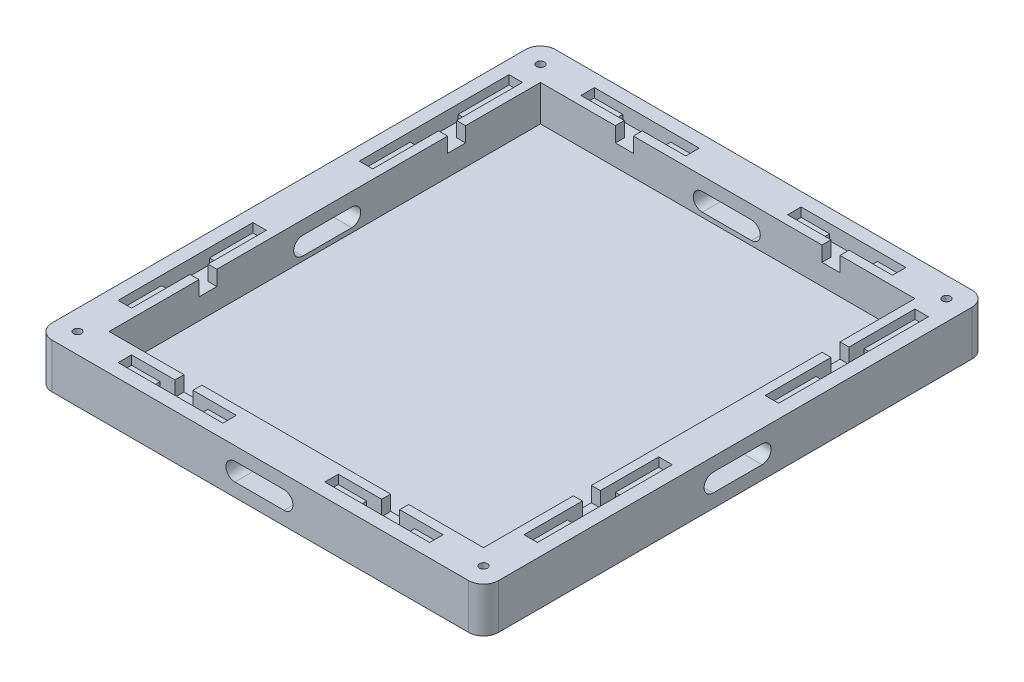
from build123d import *

# Parameters (mm, degrees)
FLOOR_2_DEPTH            = 3
BOSS_EXTRUDE1_DEPTH      = 12
BOSS_EXTRUDE1_DEPTH_BACK = 3
SKETCH4_W                = 149
SKETCH4_H                = 168
SKETCH4_W_2              = 125
SKETCH4_H_2              = 144
FILLET1_R                = 5
FILLET2_R                = 5
FILLET3_R                = 5
FILLET4_R                = 5
CUT_EXTRUDE1_DEPTH       = 3
CUT_EXTRUDE2_DEPTH       = 2
CUT_EXTRUDE3_DEPTH       = 172.703232352
CUT_EXTRUDE4_DEPTH       = 185.388855412
SKETCH9_R                = 1.325
CUT_EXTRUDE5_DEPTH       = 17
SKETCH10_R               = 3
CUT_EXTRUDE6_DEPTH       = 5
SKETCH11_R               = 6.25
CUT_EXTRUDE7_DEPTH       = 1


with BuildPart() as part:
    # Sketch1 → Floor 2 (new body)
    with BuildSketch(Plane(origin=(0, 0, 0), x_dir=(1, 0, 0), z_dir=(0, 1, 0))):
        Polygon((-62.5, 55.915), (-62.5, 72), (-47.54, 72), (46.365, 72), (62.5, 72), (62.5, 55.915), (62.5, -57.04), (62.5, -72), (46.365, -72), (-47.54, -72), (-62.5, -72), (-62.5, -57.04), align=None)
    extrude(amount=FLOOR_2_DEPTH)

    # Sketch4 → Boss-Extrude1 (add, two sides: drawn at the far end of the back side and taken through both)
    with BuildSketch(Plane(origin=(0, 3, 0), x_dir=(1, 0, 0), z_dir=(0, 1, 0)).offset(-BOSS_EXTRUDE1_DEPTH_BACK)):
        Rectangle(SKETCH4_W, SKETCH4_H)
        Rectangle(SKETCH4_W_2, SKETCH4_H_2, mode=Mode.SUBTRACT)
    extrude(amount=BOSS_EXTRUDE1_DEPTH + BOSS_EXTRUDE1_DEPTH_BACK)

    # Fillet1
    fillet1_edges = [part.edges().sort_by_distance(p)[0] for p in [
        (-74.5, 7.5, 84),
    ]]
    fillet(fillet1_edges, radius=FILLET1_R)

    # Fillet2
    fillet2_edges = [part.edges().sort_by_distance(p)[0] for p in [
        (74.5, 7.5, 84),
    ]]
    fillet(fillet2_edges, radius=FILLET2_R)

    # Fillet3
    fillet3_edges = [part.edges().sort_by_distance(p)[0] for p in [
        (74.5, 7.5, -84),
    ]]
    fillet(fillet3_edges, radius=FILLET3_R)

    # Fillet4
    fillet4_edges = [part.edges().sort_by_distance(p)[0] for p in [
        (-74.5, 7.5, -84),
    ]]
    fillet(fillet4_edges, radius=FILLET4_R)

    # Sketch5 → Cut-Extrude1 (cut)
    with BuildSketch(Plane(origin=(0, 15, 0), x_dir=(1, 0, 0), z_dir=(0, 1, 0))):
        Polygon((-62.5, 47), (-62.5, 41), (-65.5, 41), (-65.5, 19), (-70, 19), (-70, 69), (-65.5, 69), (-65.5, 47), align=None)
        Polygon((-62.5, -36), (-62.5, -42), (-65.5, -42), (-65.5, -61.5), (-70, -61.5), (-70, -16.5), (-65.5, -16.5), (-65.5, -36), align=None)
        Polygon((62.5, -36), (62.5, -42), (65.5, -42), (65.5, -61.5), (70, -61.5), (70, -16.5), (65.5, -16.5), (65.5, -36), align=None)
        Polygon((62.5, 47), (62.5, 41), (65.5, 41), (65.5, 19), (70, 19), (70, 69), (65.5, 69), (65.5, 47), align=None)
        Polygon((-37.5, 72), (-31.5, 72), (-31.5, 75), (-17, 75), (-17, 79.5), (-52, 79.5), (-52, 75), (-37.5, 75), align=None)
        Polygon((31.5, 72), (37.5, 72), (37.5, 75), (52, 75), (52, 79.5), (17, 79.5), (17, 75), (31.5, 75), align=None)
        Polygon((-37.5, -72), (-31.5, -72), (-31.5, -75), (-17, -75), (-17, -79.5), (-52, -79.5), (-52, -75), (-37.5, -75), align=None)
        Polygon((31.5, -72), (37.5, -72), (37.5, -75), (52, -75), (52, -79.5), (17, -79.5), (17, -75), (31.5, -75), align=None)
    extrude(amount=-CUT_EXTRUDE1_DEPTH, mode=Mode.SUBTRACT)

    # Sketch6 → Cut-Extrude2 (cut)
    with BuildSketch(Plane(origin=(0, 12, 0), x_dir=(1, 0, 0), z_dir=(0, 1, 0))):
        Polygon((31.5, 72), (37.5, 72), (37.5, 75), (42.5, 75), (42.5, 79.5), (26.5, 79.5), (26.5, 75), (31.5, 75), align=None)
        Polygon((62.5, 47), (62.5, 41), (65.5, 41), (65.5, 36), (70, 36), (70, 52), (65.5, 52), (65.5, 47), align=None)
        Polygon((-37.5, 72), (-31.5, 72), (-31.5, 75), (-26.5, 75), (-26.5, 79.5), (-42.5, 79.5), (-42.5, 75), (-37.5, 75), align=None)
        Polygon((-62.5, 47), (-65.5, 47), (-65.5, 52), (-70, 52), (-70, 36), (-65.5, 36), (-65.5, 41), (-62.5, 41), align=None)
        Polygon((-62.5, -36), (-65.5, -36), (-65.5, -31), (-70, -31), (-70, -47), (-65.5, -47), (-65.5, -42), (-62.5, -42), align=None)
        Polygon((-37.5, -72), (-37.5, -75), (-42.5, -75), (-42.5, -79.5), (-26.5, -79.5), (-26.5, -75), (-31.5, -75), (-31.5, -72), align=None)
        Polygon((31.5, -72), (31.5, -75), (26.5, -75), (26.5, -79.5), (42.5, -79.5), (42.5, -75), (37.5, -75), (37.5, -72), align=None)
        Polygon((62.5, -36), (62.5, -42), (65.5, -42), (65.5, -47), (70, -47), (70, -31), (65.5, -31), (65.5, -36), align=None)
    extrude(amount=-CUT_EXTRUDE2_DEPTH, mode=Mode.SUBTRACT)

    # Sketch7 → Cut-Extrude3 (cut, through all)
    with BuildSketch(Plane.ZY.offset(74.5)):
        with BuildLine():
            Line((-9, 10.5), (7.38, 10.5))
            ThreePointArc((7.38, 10.5), (10.38, 7.5), (7.38, 4.5))
            Line((7.38, 4.5), (-9, 4.5))
            ThreePointArc((-9, 4.5), (-12, 7.5), (-9, 10.5))
        make_face()
    extrude(amount=-CUT_EXTRUDE3_DEPTH, mode=Mode.SUBTRACT)

    # Sketch8 → Cut-Extrude4 (cut, through all)
    with BuildSketch(Plane.XY.offset(84)):
        with BuildLine():
            Line((-8.5, 10.5), (7.88, 10.5))
            ThreePointArc((7.88, 10.5), (10.88, 7.5), (7.88, 4.5))
            Line((7.88, 4.5), (-8.5, 4.5))
            ThreePointArc((-8.5, 4.5), (-11.5, 7.5), (-8.5, 10.5))
        make_face()
    extrude(amount=-CUT_EXTRUDE4_DEPTH, mode=Mode.SUBTRACT)

    # Sketch9 → Cut-Extrude5 (cut)
    with BuildSketch(Plane.XZ):
        with Locations((-67.767766953, 77.267766953)):
            Circle(SKETCH9_R)
        with Locations((67.767766953, 77.267766953)):
            Circle(SKETCH9_R)
        with Locations((67.767766953, -77.267766953)):
            Circle(SKETCH9_R)
        with Locations((-67.767766953, -77.267766953)):
            Circle(SKETCH9_R)
    extrude(amount=-CUT_EXTRUDE5_DEPTH, mode=Mode.SUBTRACT)

    # Sketch10 → Cut-Extrude6 (cut)
    with BuildSketch(Plane.XZ):
        with Locations((-67.767766953, 77.267766953)):
            Circle(SKETCH10_R)
        with Locations((67.767766953, 77.267766953)):
            Circle(SKETCH10_R)
        with Locations((67.767766953, -77.267766953)):
            Circle(SKETCH10_R)
        with Locations((-67.767766953, -77.267766953)):
            Circle(SKETCH10_R)
    extrude(amount=-CUT_EXTRUDE6_DEPTH, mode=Mode.SUBTRACT)

    # Sketch11 → Cut-Extrude7 (cut)
    with BuildSketch(Plane.XZ):
        with Locations((-42.5, 52)):
            Circle(SKETCH11_R)
        with Locations((42.5, 52)):
            Circle(SKETCH11_R)
        with Locations((-42.5, -52)):
            Circle(SKETCH11_R)
        with Locations((42.5, -52)):
            Circle(SKETCH11_R)
    extrude(amount=-CUT_EXTRUDE7_DEPTH, mode=Mode.SUBTRACT)


solid = part.part
